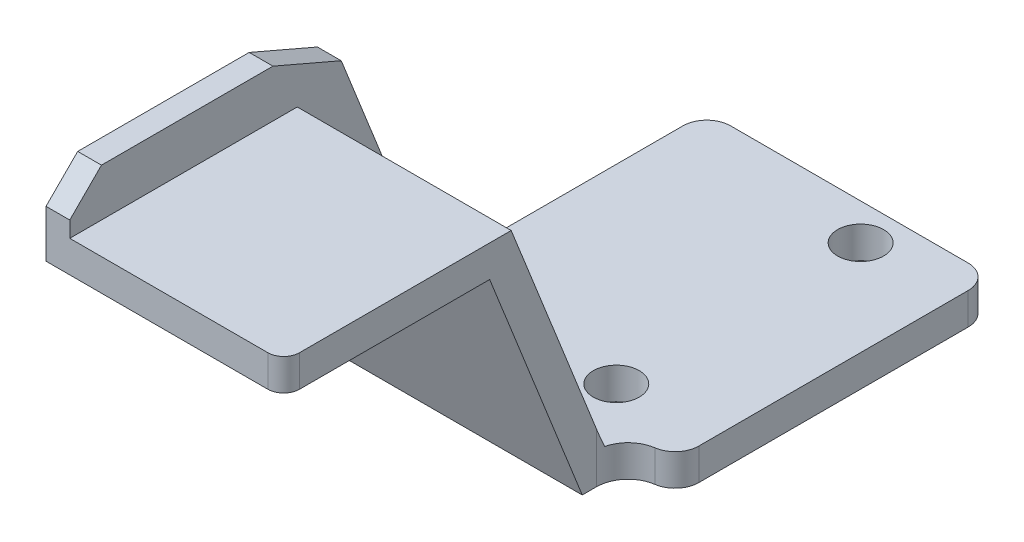
from build123d import *
from OCP.BRepFilletAPI import BRepFilletAPI_MakeChamfer

# Parameters (mm, degrees)
SKETCH1_W           = 18
SKETCH1_H           = 20
SKETCH1_R           = 1.45
BOSS_EXTRUDE1_DEPTH = 2
BOSS_EXTRUDE2_DEPTH = 15
BOSS_EXTRUDE4_DEPTH = 1.5
CHAMFER1_SIZE       = 2
CHAMFER1_SIZE2      = 3.571892366
FILLET1_R           = 1.5
FILLET2_R           = 1
FILLET3_R           = 2
FILLET_2_DEPTH      = 1.5


with BuildPart() as part:
    # Sketch1 → Boss-Extrude1 (new body)
    with BuildSketch(Plane(origin=(0, 0, 0), x_dir=(1, 0, 0), z_dir=(0, 1, 0))):
        Rectangle(SKETCH1_W, SKETCH1_H)
        with Locations(Location((3, 7.71, 0), (0, 0, 270))):
            Circle(SKETCH1_R, mode=Mode.SUBTRACT)
        with Locations(Location((3, -7.71, 0), (0, 0, 270))):
            Circle(SKETCH1_R, mode=Mode.SUBTRACT)
    extrude(amount=BOSS_EXTRUDE1_DEPTH)

    # Sketch2 → Boss-Extrude2 (add)
    with BuildSketch(Plane.ZY.offset(9)):
        Polygon((10, 2), (11.5, 2), (17.342742479, 16.7), (31.7, 16.7), (31.7, 14.7), (18.7, 14.7), (12.857257521, 0), (10, 0), align=None)
    extrude(amount=-BOSS_EXTRUDE2_DEPTH)

    # Sketch4 → Boss-Extrude4 (add)
    with BuildSketch(Plane.ZY.offset(9)):
        Polygon((31.7, 16.7), (17.342742479, 16.7), (11.5, 2), (11.5, 10.122171388), (15.306856196, 19.7), (31.7, 19.7), align=None)
    extrude(amount=-BOSS_EXTRUDE4_DEPTH)

    # Chamfer1: one chamfer whose edges measure the first distance from different faces: ONE call of the kernel's chamfer builder (chamfer() names one face for all edges)
    chamfer1_edges_1 = [part.edges().sort_by_distance(p)[0] for p in [
        (-8.25, 19.7, 31.7),
    ]]
    chamfer1_edges_2 = [part.edges().sort_by_distance(p)[0] for p in [
        (-8.25, 19.7, 15.306856196),
    ]]
    chamfer1_side_2 = [part.faces().sort_by_distance(p)[0] for p in [
        (-8.25, 14.911085694, 13.403428098),
    ]]
    chamfer1 = BRepFilletAPI_MakeChamfer(part.part.solid().wrapped)
    for e in chamfer1_edges_1:
        chamfer1.Add(CHAMFER1_SIZE, e.wrapped)
    for e in chamfer1_edges_2:
        chamfer1.Add(CHAMFER1_SIZE, CHAMFER1_SIZE2, e.wrapped, chamfer1_side_2[0].wrapped)  # the first distance lies on this face
    add(Compound.cast(chamfer1.Shape()), mode=Mode.REPLACE)

    # Fillet1
    fillet1_edges = [part.edges().sort_by_distance(p)[0] for p in [
        (-9, 1, -10),
        (9, 1, -10),
        (9, 1, 10),
    ]]
    fillet(fillet1_edges, radius=FILLET1_R)

    # Fillet2
    fillet2_edges = [part.edges().sort_by_distance(p)[0] for p in [
        (6, 15.7, 31.7),
    ]]
    fillet(fillet2_edges, radius=FILLET2_R)

    # Fillet3
    # the kernel refuses this fillet: 2 mm, written as the material it adds along each edge
    with BuildSketch(Plane(origin=(6, 0, 10), x_dir=(0, 0, 1), z_dir=(0, 1, 0))) as fillet3_piece_1_section:
        with BuildLine():
            CenterArc((1.964101615, 2), FILLET3_R, 188.213210702, 81.786789298)
            Line((-0.015385022, 1.714285714), (-0.213333686, 1.685714286))
            ThreePointArc((-0.213333686, 1.685714286), (-0.2, 1.5), (-0.2, 0))
            Line((-0.2, 0), (0, -0.2))
            Line((0, -0.2), (1.964101615, -0.2))
            Line((1.964101615, -0.2), (1.964101615, 0))
        make_face()
    fillet3_piece_1 = extrude(amount=2, mode=Mode.PRIVATE)
    fillet3_piece_1 = split(fillet3_piece_1, bisect_by=Plane(origin=(5.952622656, 0.913834891, 11.068286869), z_dir=(0, -0.3693593568576952, 0.929286643346212)), keep=Keep.TOP, mode=Mode.PRIVATE)
    add(fillet3_piece_1)
    with BuildSketch(Plane(origin=(6, 0, 10), x_dir=(0, 0, 1), z_dir=(0, 1, 0))) as fillet3_piece_2_section:
        with BuildLine():
            CenterArc((1.964101615, 2), FILLET3_R, 188.213210702, 81.786789298)
            Line((-0.015385022, 1.714285714), (-0.213333686, 1.685714286))
            ThreePointArc((-0.213333686, 1.685714286), (-0.2, 1.5), (-0.2, 0))
            Line((-0.2, 0), (0, -0.2))
            Line((0, -0.2), (1.964101615, -0.2))
            Line((1.964101615, -0.2), (1.964101615, 0))
        make_face()
    fillet3_piece_2 = extrude(amount=2, mode=Mode.PRIVATE)
    fillet3_piece_2 = split(fillet3_piece_2, bisect_by=Plane(origin=(6.444718366, 0.756232919, 11.005645527), z_dir=(0, 0.3693593568576952, -0.929286643346212)), keep=Keep.TOP, mode=Mode.PRIVATE)
    add(fillet3_piece_2)
    with BuildSketch(Plane(origin=(6, 0, 10), x_dir=(0, 0, 1), z_dir=(0, 1, 0))) as fillet3_piece_3_section:
        with BuildLine():
            CenterArc((1.964101615, 2), FILLET3_R, 188.213210702, 81.786789298)
            Line((-0.015385022, 1.714285714), (-0.213333686, 1.685714286))
            ThreePointArc((-0.213333686, 1.685714286), (-0.2, 1.5), (-0.2, 0))
            Line((-0.2, 0), (0, -0.2))
            Line((0, -0.2), (1.964101615, -0.2))
            Line((1.964101615, -0.2), (1.964101615, 0))
        make_face()
    fillet3_piece_3 = extrude(amount=6.910254038, mode=Mode.PRIVATE)
    fillet3_piece_3 = split(fillet3_piece_3, bisect_by=Plane(origin=(5.904786251, 2.434661137, 11.672762795), z_dir=(0, -0.3693593568576952, 0.929286643346212)), keep=Keep.TOP, mode=Mode.PRIVATE)
    fillet3_piece_3 = split(fillet3_piece_3, bisect_by=Plane(origin=(5.904786251, 2, 11.804045744), z_dir=(0, 1, 0)), keep=Keep.TOP, mode=Mode.PRIVATE)
    add(fillet3_piece_3)

    # Sketch5 → Fillet 2 (add)
    with BuildSketch(Plane.ZY.offset(9)):
        with BuildLine():
            Line((10, 2), (11.5, 2))
            Line((11.5, 2), (11.5, 3.5))
            ThreePointArc((11.5, 3.5), (11.060660172, 2.439339828), (10, 2))
        make_face()
    extrude(amount=-FILLET_2_DEPTH)


solid = part.part
